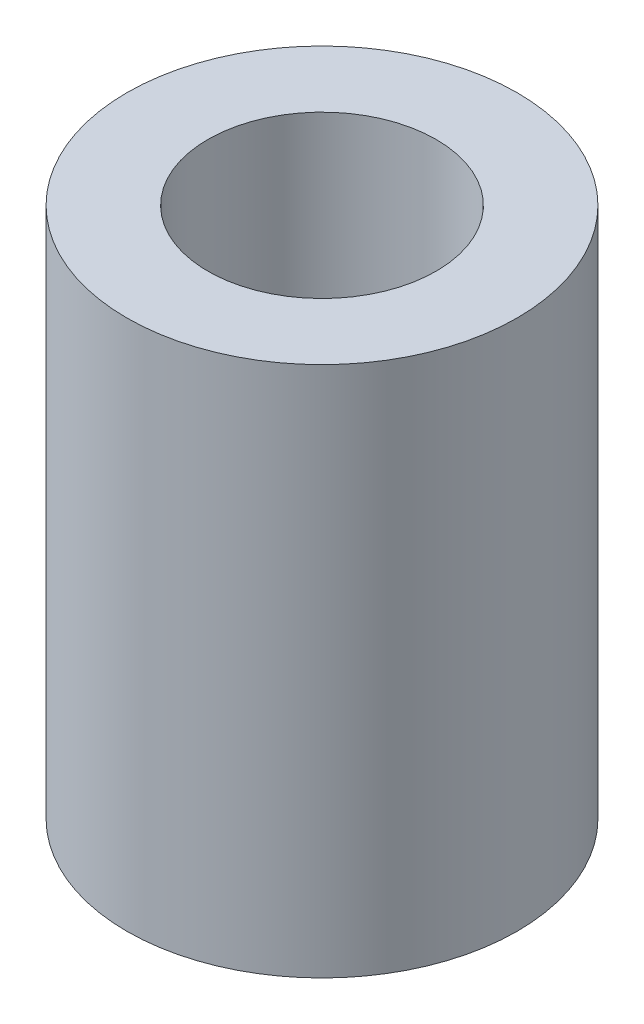
from build123d import *

# Parameters (mm, degrees)
SKETCH1_R           = 2.799145299
SKETCH1_R_2         = 1.6375
BOSS_EXTRUDE1_DEPTH = 7.62


with BuildPart() as part:
    # Sketch1 → Boss-Extrude1 (new body)
    with BuildSketch(Plane(origin=(0, 0, 0), x_dir=(1, 0, 0), z_dir=(0, 1, 0))):
        Circle(SKETCH1_R)
        Circle(SKETCH1_R_2, mode=Mode.SUBTRACT)
    extrude(amount=BOSS_EXTRUDE1_DEPTH)


solid = part.part
